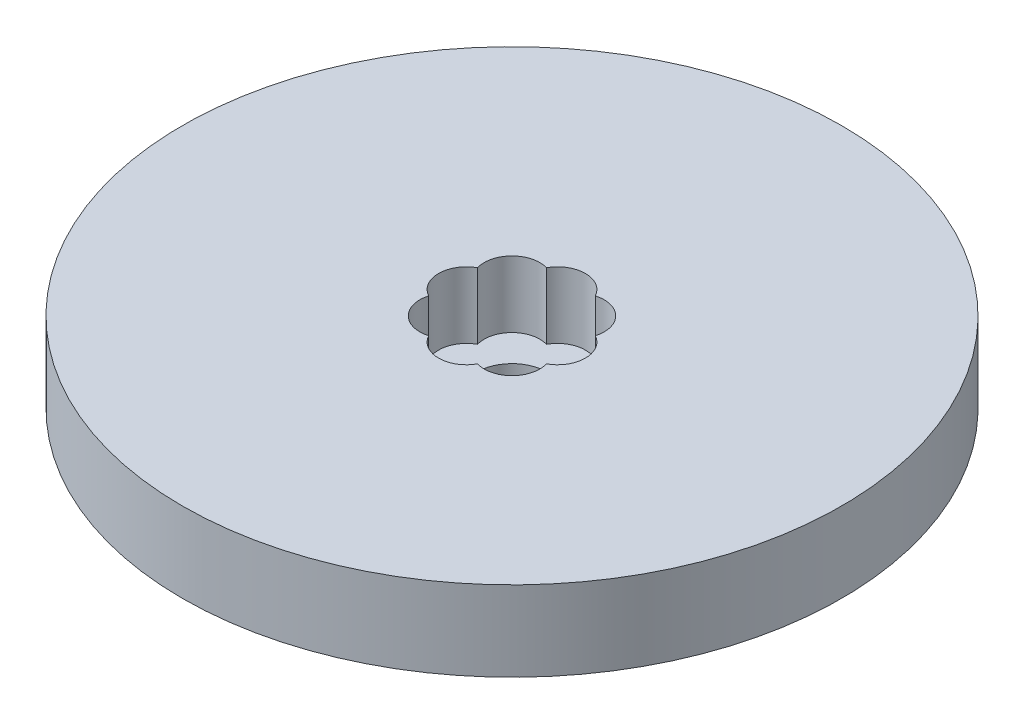
from build123d import *

# Parameters (mm, degrees)
SKETCH1_R           = 70
BOSS_EXTRUDE1_DEPTH = 17
SKETCH2_R           = 7.5
CUT_EXTRUDE1_DEPTH  = 101.444014257
SKETCH3_R           = 5.906037177
CUT_EXTRUDE2_DEPTH  = 14.097280092
CIRPATTERN1_COUNT   = 8


with BuildPart() as part:
    # Sketch1 → Boss-Extrude1 (new body)
    with BuildSketch(Plane(origin=(0, 0, 0), x_dir=(1, 0, 0), z_dir=(0, 1, 0))):
        Circle(SKETCH1_R)
    extrude(amount=BOSS_EXTRUDE1_DEPTH)

    # Sketch2 → Cut-Extrude1 (cut, through all)
    with BuildSketch(Plane(origin=(0, 0, 0), x_dir=(1, 0, 0), z_dir=(0, 1, 0))):
        Circle(SKETCH2_R)
    extrude(amount=CUT_EXTRUDE1_DEPTH, mode=Mode.SUBTRACT)

    # Sketch3 → Cut-Extrude2 (cut)
    with BuildSketch(Plane(origin=(0, 17, 0), x_dir=(1, 0, 0), z_dir=(0, 1, 0))):
        with Locations((-9.676366693, 0)):
            Circle(SKETCH3_R)
    cut_extrude2 = extrude(amount=-CUT_EXTRUDE2_DEPTH, mode=Mode.SUBTRACT)

    # CirPattern1: Cut-Extrude2 ×8 about axis
    cirpattern1_axis = Axis((0, 0, 0), (0, 1, 0))
    for i in range(1, CIRPATTERN1_COUNT):
        add(cut_extrude2.rotate(cirpattern1_axis, i * 360 / CIRPATTERN1_COUNT), mode=Mode.SUBTRACT)


solid = part.part
